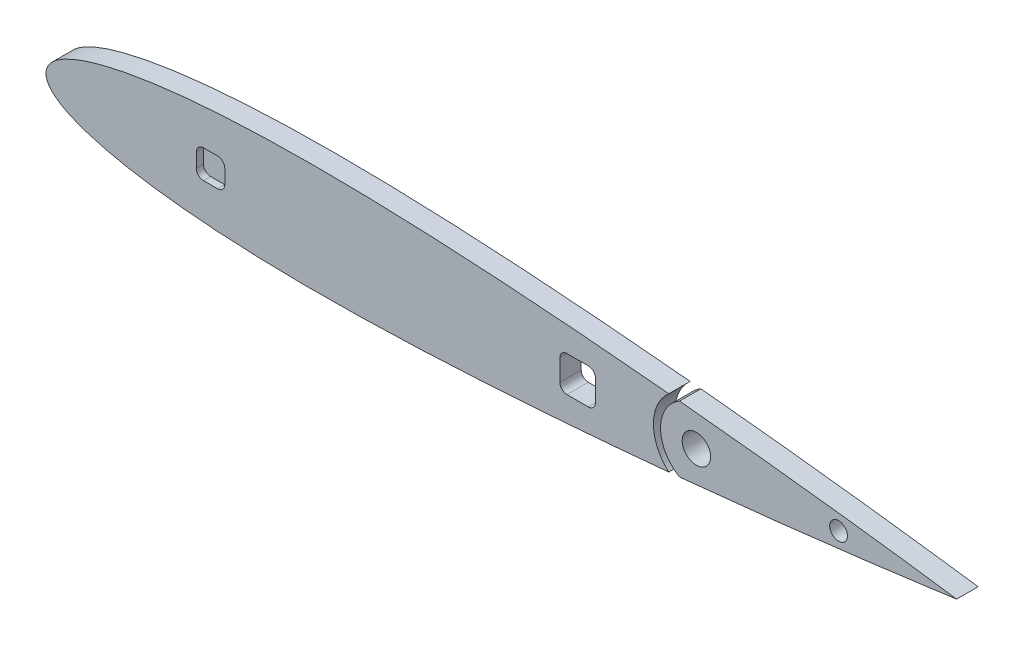
from build123d import *

# Parameters (mm, degrees)
RESSALTO_EXTRUS_O1_OUTLINE_R   = 4
RESSALTO_EXTRUS_O1_OUTLINE_R_2 = 2.5
RESSALTO_EXTRUS_O1_DEPTH       = 6
CORTE_EXTRUS_O1_DEPTH          = 2
CORTE_EXTRUS_O2_DEPTH          = 2


# Read off the part's stored shape, not the designer's step: Ressalto-extrusão1
with BuildPart() as part:
    # Ressalto-extrusão1 outline → Ressalto-extrusão1 (new body)
    # profile 1 of 2: a face of its own
    with BuildSketch(Plane.XY):
        with BuildLine():
            ThreePointArc((178.3, 9.259768845), (172.953869965, 0), (178.3, -9.259768845))
            add(Edge.make_bspline(
                [(178.3, -9.259768845), (179.966948912, -9.097173464), (183.445872321, -8.753152805), (188.68785969, -8.21950013), (193.974554518, -7.66717356), (199.104769106, -7.11640957), (204.066722569, -6.571144014), (208.848668706, -6.032841378), (213.439589199, -5.505363168), (217.828500467, -4.990056498), (222.005313283, -4.490008279), (225.960300672, -4.007831381), (229.68419663, -3.545678166), (233.168269855, -3.105938896), (236.40440925, -2.691690119), (239.385003595, -2.303979488), (242.103156271, -1.945919059), (244.552524456, -1.619190737), (246.727445017, -1.32614033), (248.622675623, -1.068020882), (250.233997703, -0.846504296), (251.557050419, -0.663986384), (252.590679655, -0.520240199), (253.327462597, -0.416906365), (253.776091936, -0.354769376), (254.711719333, -0.220284067), (256.3, -0.106670993), (256.3, 0), (256.3, 0.106670993), (254.711719333, 0.220284067), (253.776091936, 0.354769376), (253.327462597, 0.416906365), (252.590679655, 0.520240199), (251.557050419, 0.663986384), (250.233997703, 0.846504296), (248.622675623, 1.068020882), (246.727445017, 1.32614033), (244.552524456, 1.619190737), (242.103156271, 1.945919059), (239.385003595, 2.303979488), (236.40440925, 2.691690119), (233.168269855, 3.105938896), (229.68419663, 3.545678166), (225.960300672, 4.007831381), (222.005313283, 4.490008279), (217.828500467, 4.990056498), (213.439589199, 5.505363168), (208.848668706, 6.032841378), (204.066722569, 6.571144014), (199.104769106, 7.11640957), (193.974554518, 7.66717356), (188.68785969, 8.21950013), (183.445872321, 8.753152805), (179.966948912, 9.097173464), (178.3, 9.259768845)],
                knots=[0.849684747, 0.849684747, 0.849684747, 0.849684747, 0.859299454, 0.869753257, 0.879932425, 0.889813425, 0.899372991, 0.908588481, 0.917438048, 0.925901016, 0.933956533, 0.941586686, 0.948773131, 0.955497933, 0.961746042, 0.967502103, 0.972752493, 0.97748467, 0.981687532, 0.98535058, 0.988465174, 0.99102363, 0.99302004, 0.994449737, 0.995308667, 0.995595321, 1, 1, 1, 1.004404679, 1.004691333, 1.005550263, 1.00697996, 1.00897637, 1.011534826, 1.01464942, 1.018312468, 1.02251533, 1.027247507, 1.032497897, 1.038253958, 1.044502067, 1.051226869, 1.058413314, 1.066043467, 1.074098984, 1.082561952, 1.091411519, 1.100627009, 1.110186575, 1.120067575, 1.130246743, 1.140700546, 1.150315253, 1.150315253, 1.150315253, 1.150315253], degree=3))
        make_face()
        with Locations((183.05, 0)):
            Circle(RESSALTO_EXTRUS_O1_OUTLINE_R, mode=Mode.SUBTRACT)
        with Locations((223.05, 0)):
            Circle(RESSALTO_EXTRUS_O1_OUTLINE_R_2, mode=Mode.SUBTRACT)
    # profile 2 of 2: a face of its own
    with BuildSketch(Plane.XY):
        with BuildLine():
            add(Edge.make_bspline(
                [(175.287382607, 9.551167841), (174.207965209, 9.654685452), (171.198874041, 9.940555484), (166.229022592, 10.399667358), (160.351815772, 10.923162493), (154.396735285, 11.431357512), (148.377658827, 11.921979348), (142.308720286, 12.391894821), (136.204016556, 12.837331642), (130.077893929, 13.255496113), (123.944653006, 13.643047983), (117.818490267, 13.996244432), (111.713827177, 14.312292337), (105.64478211, 14.587741364), (99.625579188, 14.819523055), (93.670366494, 15.005064191), (87.793008994, 15.141064398), (82.007227866, 15.225126103), (76.326395242, 15.254886657), (70.763890367, 15.22857762), (65.332731596, 15.145016118), (60.045645868, 15.001676848), (54.914863551, 14.79919411), (49.952356648, 14.536113044), (45.169678516, 14.213170989), (40.57809127, 13.830435299), (36.188270081, 13.388601619), (32.010414838, 12.889346003), (28.054157141, 12.334697787), (24.328816977, 11.725690904), (20.842932132, 11.065369069), (17.604525309, 10.356215177), (14.621164931, 9.600633189), (11.899443292, 8.802008), (9.445361787, 7.962991828), (7.264153877, 7.086482459), (5.360137362, 6.175008453), (3.736939642, 5.230467455), (2.396450862, 4.254460648), (1.341261213, 3.245382554), (0.573915311, 2.200374626), (0.104758816, 1.114328986), (-0.051063833, 0), (0.104758816, -1.114328986), (0.573915311, -2.200374626), (1.341261213, -3.245382554), (2.396450862, -4.254460648), (3.736939642, -5.230467455), (5.360137362, -6.175008453), (7.264153877, -7.086482459), (9.445361787, -7.962991828), (11.899443292, -8.802008), (14.621164931, -9.600633189), (17.604525309, -10.356215177), (20.842932132, -11.065369069), (24.328816977, -11.725690904), (28.054157141, -12.334697787), (32.010414838, -12.889346003), (36.188270081, -13.388601619), (40.57809127, -13.830435299), (45.169678516, -14.213170989), (49.952356648, -14.536113044), (54.914863551, -14.79919411), (60.045645868, -15.001676848), (65.332731596, -15.145016118), (70.763890367, -15.22857762), (76.326395242, -15.254886657), (82.007227866, -15.225126103), (87.793008994, -15.141064398), (93.670366494, -15.005064191), (99.625579188, -14.819523055), (105.64478211, -14.587741364), (111.713827177, -14.312292337), (117.818490267, -13.996244432), (123.944653006, -13.643047983), (130.077893929, -13.255496113), (136.204016556, -12.837331642), (142.308720286, -12.391894821), (148.377658827, -11.921979348), (154.396735285, -11.431357512), (160.351815772, -10.923162493), (166.229022592, -10.399667358), (171.198874041, -9.940555484), (174.207965209, -9.654685452), (175.287382607, -9.551167841)],
                knots=[0.156106905, 0.156106905, 0.156106905, 0.156106905, 0.162331842, 0.173458675, 0.18475829, 0.196204076, 0.207768618, 0.219425945, 0.231147635, 0.242906359, 0.254675296, 0.26642621, 0.278132455, 0.289766477, 0.301301814, 0.312711646, 0.323969259, 0.33505005, 0.345928599, 0.356580621, 0.366981996, 0.377109776, 0.386942119, 0.396457905, 0.405636645, 0.41445907, 0.42290662, 0.430962851, 0.438611618, 0.445838275, 0.452630377, 0.458976173, 0.4648663, 0.470293868, 0.475254829, 0.479749124, 0.483781006, 0.48736258, 0.490515632, 0.493278566, 0.495712194, 0.497909944, 0.5, 0.502090056, 0.504287806, 0.506721434, 0.509484368, 0.51263742, 0.516218994, 0.520250876, 0.524745171, 0.529706132, 0.5351337, 0.541023827, 0.547369623, 0.554161725, 0.561388382, 0.569037149, 0.57709338, 0.58554093, 0.594363355, 0.603542095, 0.613057881, 0.622890224, 0.633018004, 0.643419379, 0.654071401, 0.66494995, 0.676030741, 0.687288354, 0.698698186, 0.710233523, 0.721867545, 0.73357379, 0.745324704, 0.757093641, 0.768852365, 0.780574055, 0.792231382, 0.803795924, 0.81524171, 0.826541325, 0.837668158, 0.843893095, 0.843893095, 0.843893095, 0.843893095], degree=3))
            ThreePointArc((175.287382607, -9.551167841), (170.953869965, 0), (175.287382607, 9.551167841))
        make_face()
        with BuildLine():
            Line((144.63333333, -3), (144.63333333, 3))
            ThreePointArc((144.63333333, 3), (145.219119768, 4.414213562), (146.63333333, 5))
            Line((146.63333333, 5), (152.63333333, 5))
            ThreePointArc((152.63333333, 5), (154.047546892, 4.414213562), (154.63333333, 3))
            Line((154.63333333, 3), (154.63333333, -3))
            ThreePointArc((154.63333333, -3), (154.047546892, -4.414213562), (152.63333333, -5))
            Line((152.63333333, -5), (146.63333333, -5))
            ThreePointArc((146.63333333, -5), (145.219119768, -4.414213562), (144.63333333, -3))
        make_face(mode=Mode.SUBTRACT)
    extrude(amount=RESSALTO_EXTRUS_O1_DEPTH)

    # Esboço3 → Corte-extrusão1 (cut)
    with BuildSketch(Plane(origin=(0, 0, 0), x_dir=(-1, 0, 0), z_dir=(0, 0, -1))):
        with BuildLine():
            Line((-17, -4), (-13, -4))
            ThreePointArc((-13, -4), (-11.585786438, -3.414213562), (-11, -2))
            Line((-11, -2), (-11, 2))
            ThreePointArc((-11, 2), (-11.585786438, 3.414213562), (-13, 4))
            Line((-13, 4), (-17, 4))
            ThreePointArc((-17, 4), (-18.414213562, 3.414213562), (-19, 2))
            Line((-19, 2), (-19, -2))
            ThreePointArc((-19, -2), (-18.414213562, -3.414213562), (-17, -4))
        make_face()
    extrude(amount=-CORTE_EXTRUS_O1_DEPTH, mode=Mode.SUBTRACT)

    # Esboço4 → Corte-extrusão2 (cut)
    with BuildSketch(Plane.XY.offset(6)):
        with BuildLine():
            Line((44.31, -4), (48.31, -4))
            ThreePointArc((48.31, -4), (49.724213562, -3.414213562), (50.31, -2))
            Line((50.31, -2), (50.31, 2))
            ThreePointArc((50.31, 2), (49.724213562, 3.414213562), (48.31, 4))
            Line((48.31, 4), (44.31, 4))
            ThreePointArc((44.31, 4), (42.895786438, 3.414213562), (42.31, 2))
            Line((42.31, 2), (42.31, -2))
            ThreePointArc((42.31, -2), (42.895786438, -3.414213562), (44.31, -4))
        make_face()
    extrude(amount=-CORTE_EXTRUS_O2_DEPTH, mode=Mode.SUBTRACT)


solid = part.part
